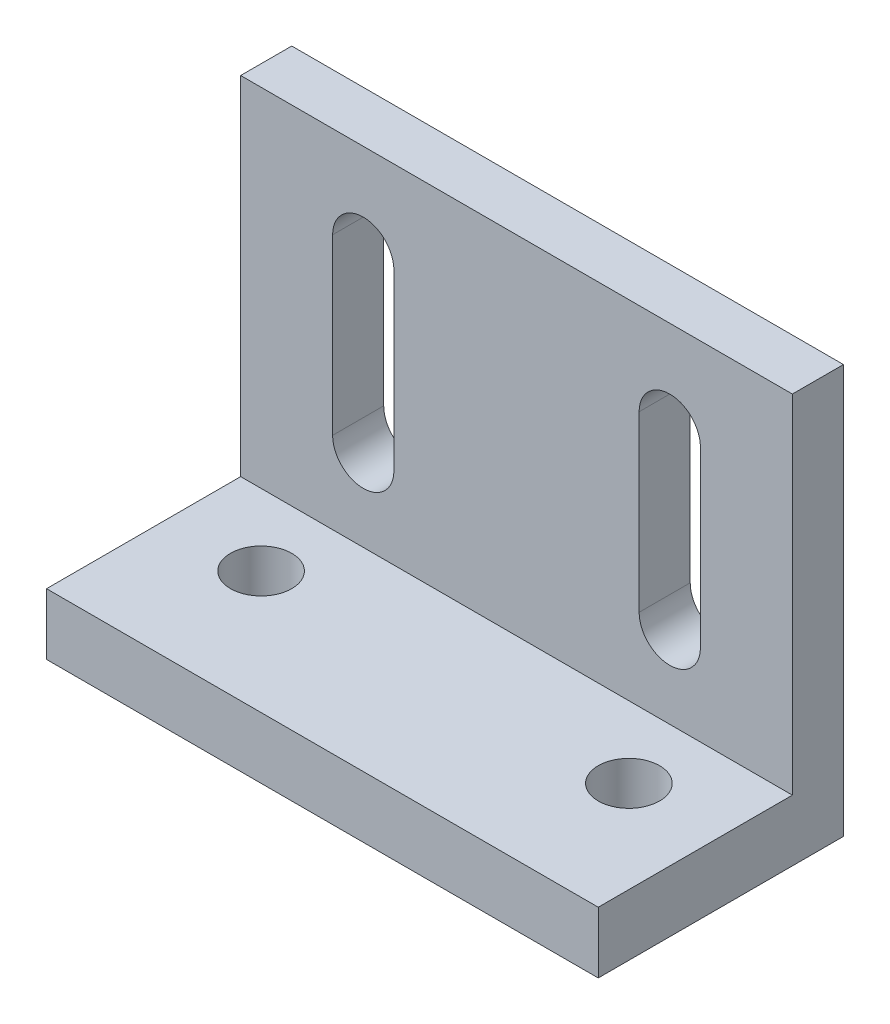
from build123d import *

# Parameters (mm, degrees)
BOSS_EXTRUDE1_DEPTH = 13.5
SKETCH2_R           = 1.5
CUT_EXTRUDE1_DEPTH  = 20
CUT_EXTRUDE2_DEPTH  = 26.93260496


with BuildPart() as part:
    # Sketch1 → Boss-Extrude1 (new, symmetric)
    with BuildSketch(Plane(origin=(0, 0, 0), x_dir=(0, 0, -1), z_dir=(1, 0, 0))):
        Polygon((0, 0), (-12, 0), (-12, 3), (-2.5, 3), (-2.5, 20), (0, 20), align=None)
    extrude(amount=BOSS_EXTRUDE1_DEPTH, both=True)

    # Sketch2 → Cut-Extrude1 (cut)
    with BuildSketch(Plane(origin=(0, 3, 0), x_dir=(1, 0, 0), z_dir=(0, 1, 0))):
        with Locations((-9, -6)):
            Circle(SKETCH2_R)
        with Locations((9, -6)):
            Circle(SKETCH2_R)
    extrude(amount=-CUT_EXTRUDE1_DEPTH, mode=Mode.SUBTRACT)

    # Sketch3 → Cut-Extrude2 (cut, through all)
    with BuildSketch(Plane.XY.offset(2.5)):
        with BuildLine():
            Line((-6.000505089, 15.5), (-6.000505089, 7))
            ThreePointArc((-6.000505089, 7), (-7.5, 5.500505089), (-8.999494911, 7))
            Line((-8.999494911, 7), (-8.999494911, 15.5))
            ThreePointArc((-8.999494911, 15.5), (-7.5, 16.999494911), (-6.000505089, 15.5))
        make_face()
        with BuildLine():
            Line((8.999494911, 15.5), (8.999494911, 7))
            ThreePointArc((8.999494911, 7), (7.5, 5.500505089), (6.000505089, 7))
            Line((6.000505089, 7), (6.000505089, 15.5))
            ThreePointArc((6.000505089, 15.5), (7.5, 16.999494911), (8.999494911, 15.5))
        make_face()
    extrude(amount=-CUT_EXTRUDE2_DEPTH, mode=Mode.SUBTRACT)


solid = part.part
